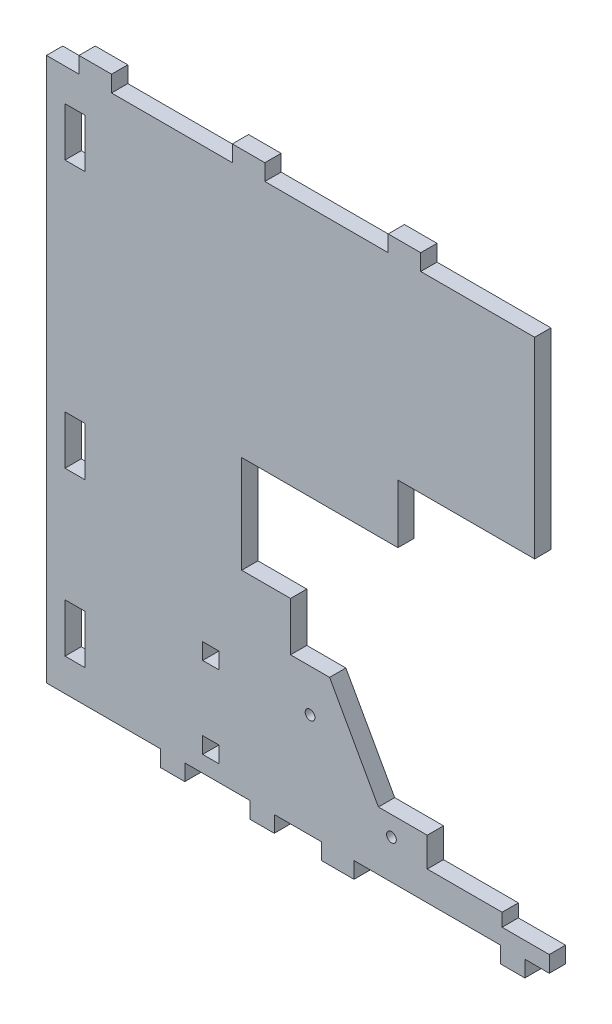
from build123d import *

# Parameters (mm, degrees)
ESQUISSE1_R        = 1.5
BOSS_EXTRU_1_DEPTH = 5
ESQUISSE2_W        = 6.138933528
ESQUISSE2_H        = 15
ESQUISSE2_W_2      = 5
ESQUISSE2_H_2      = 5
BOSS_EXTRU_2_DEPTH = 5
ESQUISSE3_W        = 10
ESQUISSE3_H        = 5
BOSS_EXTRU_3_DEPTH = 5


with BuildPart() as part:
    # Esquisse1 → Boss.-Extru.1 (new body)
    with BuildSketch(Plane.XY):
        Polygon((0, 0), (37, 0), (37, 18), (27, 18), (12, 45), (0, 45), align=None)
        with Locations((6, 32)):
            Circle(ESQUISSE1_R, mode=Mode.SUBTRACT)
        with Locations((31, 12)):
            Circle(ESQUISSE1_R, mode=Mode.SUBTRACT)
    extrude(amount=BOSS_EXTRU_1_DEPTH)

    # Esquisse2 → Boss.-Extru.2 (add)
    # profile 1 of 2: a face of its own
    with BuildSketch(Plane.XY.offset(5)):
        Polygon((37, 18), (37, 0), (64.5, 0), (64.5, -5), (72, -5), (72, 0), (79.5, 0), (79.5, 5), (65, 5), (65, 9), (42, 9), (42, 18), align=None)
    # profile 2 of 2: a face of its own
    with BuildSketch(Plane.XY.offset(5)):
        Polygon((-5, 0), (0, 0), (0, 60), (-15, 60), (-15, 90), (33, 90), (33, 108), (75, 108), (75, 167), (40, 167), (40, 172), (30, 172), (30, 167), (-55, 167), (-55, 172), (-65, 172), (-65, 167), (-75, 167), (-75, 0), (-40, 0), (-40, -5), (-32.5, -5), (-32.5, 0), (-12.5, 0), (-12.5, -5), (-5, -5), align=None)
        with Locations((-66.228617731, 17.5)):
            Rectangle(ESQUISSE2_W, ESQUISSE2_H, mode=Mode.SUBTRACT)
        with Locations((-24.5, 7.5)):
            Rectangle(ESQUISSE2_W_2, ESQUISSE2_H_2, mode=Mode.SUBTRACT)
        with Locations((-24.5, 32.5)):
            Rectangle(ESQUISSE2_W_2, ESQUISSE2_H_2, mode=Mode.SUBTRACT)
        with Locations((-66.228617731, 67.5)):
            Rectangle(ESQUISSE2_W, ESQUISSE2_H, mode=Mode.SUBTRACT)
        with Locations((-66.228617731, 149.5)):
            Rectangle(ESQUISSE2_W, ESQUISSE2_H, mode=Mode.SUBTRACT)
    extrude(amount=-BOSS_EXTRU_2_DEPTH)

    # Esquisse3 → Boss.-Extru.3 (add)
    with BuildSketch(Plane(origin=(0, 0, 0), x_dir=(-1, 0, 0), z_dir=(0, 0, -1))):
        with Locations((-14.5, -2.5)):
            Rectangle(ESQUISSE3_W, ESQUISSE3_H)
        with Locations((12.893402511, 169.5)):
            Rectangle(ESQUISSE3_W, ESQUISSE3_H)
    extrude(amount=-BOSS_EXTRU_3_DEPTH)


solid = part.part
